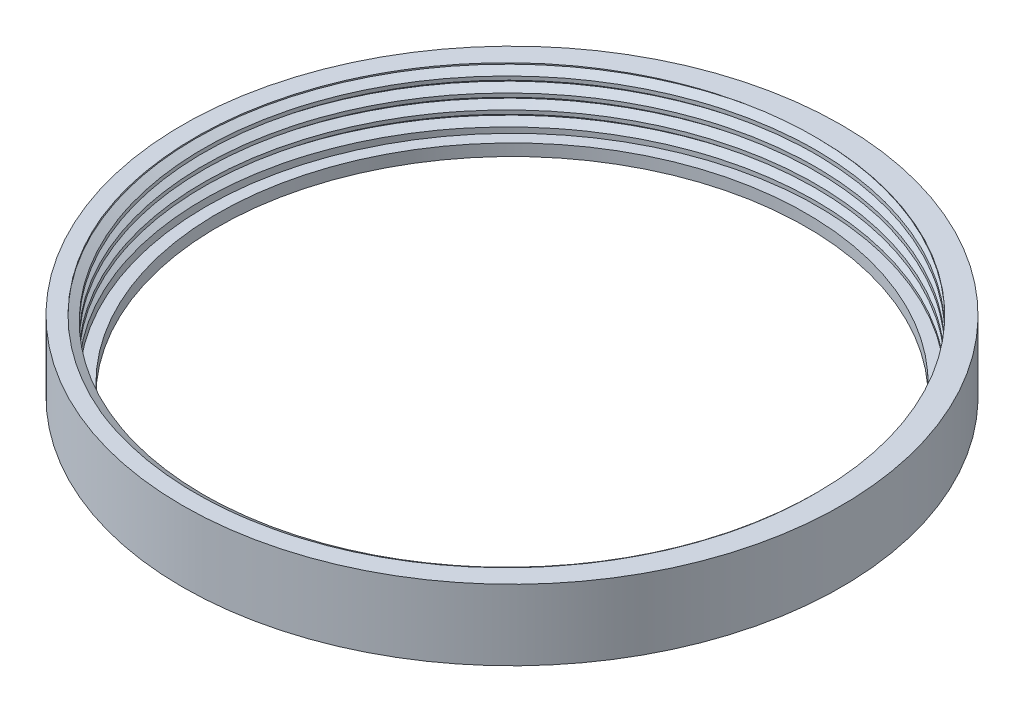
from build123d import *

# Parameters (mm, degrees)
SKETCH1_R           = 56
SKETCH1_R_2         = 52
SKETCH1_R_3         = 50
BOSS_EXTRUDE1_DEPTH = 2
SKETCH1_7_R         = 56
SKETCH1_7_R_2       = 52
BOSS_EXTRUDE2_DEPTH = 12
THREAD2_PITCH       = 2.5


with BuildPart() as part:
    # Sketch1 → Boss-Extrude1 (new body)
    # profile 1 of 2: a face of its own
    with BuildSketch(Plane(origin=(0, 0, 0), x_dir=(1, 0, 0), z_dir=(0, 1, 0))):
        with Locations(Location((0, 0, 0), (0, 0, 270))):
            Circle(SKETCH1_R)
        Circle(SKETCH1_R_2, mode=Mode.SUBTRACT)
    # profile 2 of 2: a face of its own
    with BuildSketch(Plane(origin=(0, 0, 0), x_dir=(1, 0, 0), z_dir=(0, 1, 0))):
        Circle(SKETCH1_R_2)
        with Locations(Location((0, 0, 0), (0, 0, 270))):
            Circle(SKETCH1_R_3, mode=Mode.SUBTRACT)
    extrude(amount=BOSS_EXTRUDE1_DEPTH)

    # Sketch1<7> → Boss-Extrude2 (add)
    with BuildSketch(Plane(origin=(0, 0, 0), x_dir=(1, 0, 0), z_dir=(0, 1, 0))):
        with Locations(Location((0, 0, 0), (0, 0, 270))):
            Circle(SKETCH1_7_R)
        with Locations(Location((0, 0, 0), (0, 0, 270))):
            Circle(SKETCH1_7_R_2, mode=Mode.SUBTRACT)
    extrude(amount=BOSS_EXTRUDE2_DEPTH)

    # Thread2: the profile of Thread Profile2 profile screwed along a right-hand helix of 4 turns, 10 arcs to a turn; built about Z, then put on its axis
    thread2_z = Axis((0, 0, 0), (0, 0, 1))
    thread2_corners = [(51.9997, 0, -0.000173205), (53.353164688, 0, 0.781249997), (53.353164688, 0, 1.093749997), (51.9997, 0, 1.875173198)]
    with BuildLine(mode=Mode.PRIVATE) as thread2_profile:
        Line(thread2_corners[0], thread2_corners[1])
        Line(thread2_corners[1], thread2_corners[2])
        Line(thread2_corners[2], thread2_corners[3])
        Line(thread2_corners[3], thread2_corners[0])
    thread2_cap = Face(thread2_profile.wire())
    thread2_turn_angles = [0, 18, 36, 54, 72, 90, 108, 126, 144, 162, 180, 198, 216, 234, 252, 270, 288, 306, 324, 342, 360]
    thread2_turn_weights = [1, 0.9510565162951535, 1, 0.9510565162951535, 1, 0.9510565162951535, 1, 0.9510565162951535, 1, 0.9510565162951535, 1, 0.9510565162951535, 1, 0.9510565162951535, 1, 0.9510565162951535, 1, 0.9510565162951535, 1, 0.9510565162951535, 1]
    thread2_turn_rails = [Edge.make_bspline([Vector(p[0], p[1], 0).rotate(thread2_z, thread2_turn_angles[k]) / thread2_turn_weights[k] + Vector(0, 0, p[2] + THREAD2_PITCH * thread2_turn_angles[k] / 360) for k in range(21)], [0, 0, 0, 1, 1, 2, 2, 3, 3, 4, 4, 5, 5, 6, 6, 7, 7, 8, 8, 9, 9, 10, 10, 10], 2, thread2_turn_weights) for p in thread2_corners]
    thread2_turn_sides = [Face.make_surface_from_curves(thread2_turn_rails[p[0]], thread2_turn_rails[p[1]]) for p in [(0, 1), (1, 2), (2, 3), (3, 0)]]
    thread2 = Plane(origin=(0, 2, 0), x_dir=(1, 0, 0), z_dir=(0, 1, 0)) * Solid(Shell([*[p.moved(Location((0, 0, THREAD2_PITCH * i))) for i in range(4) for p in thread2_turn_sides], thread2_cap, thread2_cap.rotate(thread2_z, 1440).moved(Location((0, 0, THREAD2_PITCH * 1440 / 360)))]))
    add(thread2, mode=Mode.SUBTRACT)


solid = part.part
